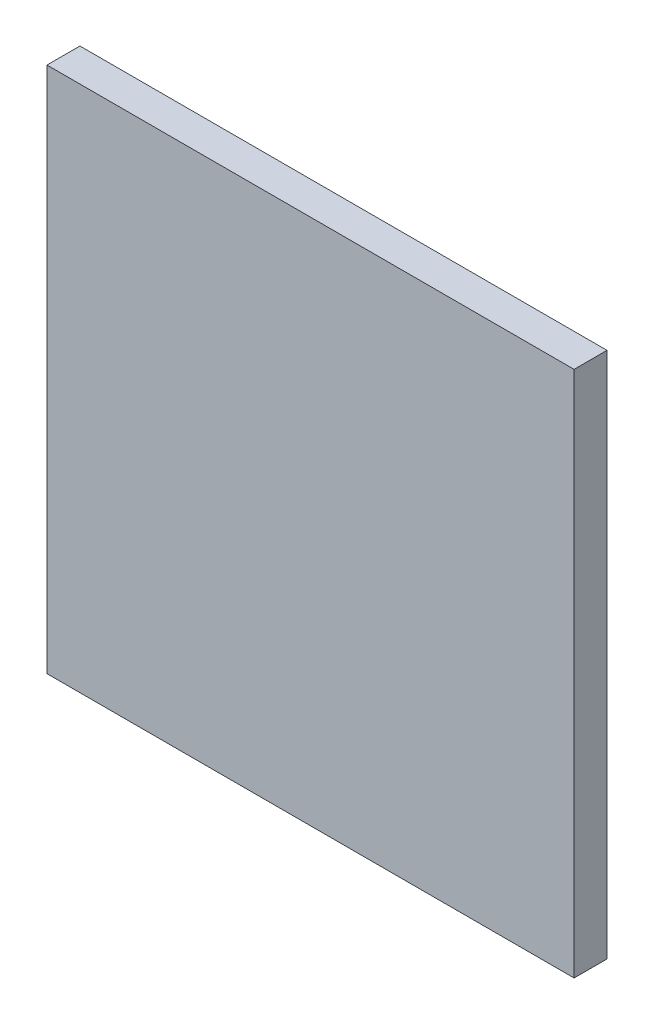
from build123d import *

# Parameters (mm, degrees)
SKETCH1_W           = 50.8
SKETCH1_H           = 50.8
BOSS_EXTRUDE1_DEPTH = 3.175


with BuildPart() as part:
    # Sketch1 → Boss-Extrude1 (new body)
    with BuildSketch(Plane.XY):
        with Locations((25.4, 25.4)):
            Rectangle(SKETCH1_W, SKETCH1_H)
    extrude(amount=BOSS_EXTRUDE1_DEPTH)


solid = part.part
